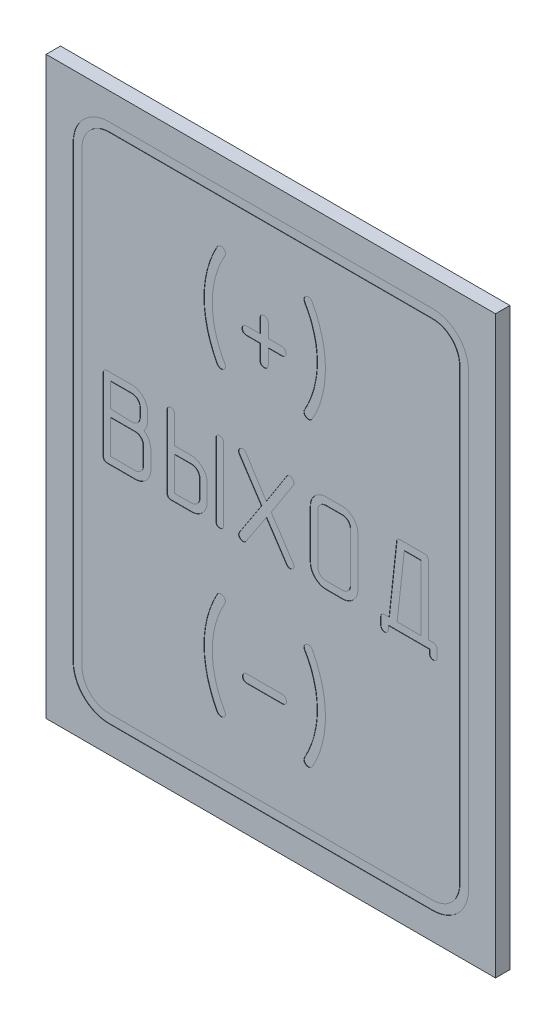
from build123d import *

# Parameters (mm, degrees)
SKETCH_1_W               = 25
SKETCH_1_H               = 32
EXTRUDE_1_DEPTH          = 0.8
CUT_EXTRUDE_1_DEPTH      = 0.02
CUT_EXTRUDE_1_DEPTH_BACK = 0.02
CUT_EXTRUDE_1_2_DEPTH    = 0.02


with BuildPart() as part:
    # Эскиз1 → Вытянуть1 (new body)
    with BuildSketch(Plane.XY):
        Rectangle(SKETCH_1_W, SKETCH_1_H)
    extrude(amount=EXTRUDE_1_DEPTH)

    # Эскиз2 → Cut-Extrude 1 (cut, two sides: drawn at the far end of the back side and taken through both)
    with BuildSketch(Plane.XY.offset(0.8).offset(-CUT_EXTRUDE_1_DEPTH_BACK)):
        with BuildLine():
            Line((-9, -14.5), (9, -14.5))
            ThreePointArc((9, -14.5), (10.414213562, -13.914213562), (11, -12.5))
            Line((11, -12.5), (11, 12.5))
            ThreePointArc((11, 12.5), (10.414213562, 13.914213562), (9, 14.5))
            Line((9, 14.5), (-9, 14.5))
            ThreePointArc((-9, 14.5), (-10.414213562, 13.914213562), (-11, 12.5))
            Line((-11, 12.5), (-11, -12.5))
            ThreePointArc((-11, -12.5), (-10.414213562, -13.914213562), (-9, -14.5))
        make_face()
        with BuildLine():
            Line((-9, -14), (9, -14))
            ThreePointArc((9, -14), (10.060660172, -13.560660172), (10.5, -12.5))
            Line((10.5, -12.5), (10.5, 12.5))
            ThreePointArc((10.5, 12.5), (10.060660172, 13.560660172), (9, 14))
            Line((9, 14), (-9, 14))
            ThreePointArc((-9, 14), (-10.060660172, 13.560660172), (-10.5, 12.5))
            Line((-10.5, 12.5), (-10.5, -12.5))
            ThreePointArc((-10.5, -12.5), (-10.060660172, -13.560660172), (-9, -14))
        make_face(mode=Mode.SUBTRACT)
    extrude(amount=CUT_EXTRUDE_1_DEPTH + CUT_EXTRUDE_1_DEPTH_BACK, mode=Mode.SUBTRACT)

    # Эскиз3 → Cut-Extrude 1 2 (cut)
    # profile 1 of 12: a face of its own
    with BuildSketch(Plane.XY.offset(0.8)):
        with BuildLine():
            add(Edge.make_bspline(
                [(-7.058321948, 0.591776836), (-7.027742918, 0.571346925), (-6.966808596, 0.530636582), (-6.888528762, 0.452906934), (-6.821275379, 0.364324674), (-6.768985356, 0.264195286), (-6.726289918, 0.158129073), (-6.696584245, 0.047007104), (-6.676481874, -0.067218704), (-6.67469526, -0.144829501), (-6.673796512, -0.183871286)],
                knots=[0, 0, 0, 0, 0.974313857, 1.941498972, 2.912237091, 3.915945845, 4.93030387, 5.941881181, 6.964671993, 8, 8, 8, 8], degree=3))
            Line((-6.673796512, -0.183871286), (-6.673796512, -1.091464411))
            add(Edge.make_bspline(
                [(-6.673796512, -1.091464411), (-6.674444225, -1.121976953), (-6.675725056, -1.182314435), (-6.688214502, -1.271083799), (-6.709247409, -1.356478441), (-6.73747977, -1.438563391), (-6.77338716, -1.517889835), (-6.818958703, -1.592968858), (-6.872237386, -1.664954939), (-6.932042309, -1.733453457), (-6.997851717, -1.795850195), (-7.0684157, -1.849758437), (-7.141124286, -1.896680786), (-7.217987037, -1.934483467), (-7.298545154, -1.964016249), (-7.382728539, -1.984140185), (-7.469695008, -1.99842847), (-7.528866371, -1.999472411), (-7.558770493, -2)],
                knots=[0, 0, 0, 0, 1.038553944, 2.05370399, 3.044839953, 4.029314396, 5.005852223, 6.003891933, 7.013786344, 8.052340288, 9.096663258, 10.095906219, 11.072268247, 12.038675251, 13.006561345, 13.987308911, 14.982822805, 16, 16, 16, 16], degree=3))
            Line((-7.558770493, -2), (-9.10629688, -2))
            add(Edge.make_bspline(
                [(-9.10629688, -2), (-9.123633505, -1.999287823), (-9.156451599, -1.997939677), (-9.202172301, -1.987712837), (-9.2414509, -1.970721039), (-9.273573689, -1.945410209), (-9.298240078, -1.912858752), (-9.315536564, -1.873485464), (-9.325771658, -1.827415576), (-9.327079348, -1.794285374), (-9.327775992, -1.77663596)],
                knots=[0, 0, 0, 0, 1.153916628, 2.184355167, 3.102198918, 3.981299518, 4.876930186, 5.794773937, 6.825212475, 8, 8, 8, 8], degree=3))
            Line((-9.327775992, -1.77663596), (-9.327775992, 2.240146904))
            add(Edge.make_bspline(
                [(-9.327775992, 2.240146904), (-9.32704669, 2.257781309), (-9.325677698, 2.290883337), (-9.315817034, 2.337268107), (-9.297102006, 2.37614052), (-9.272692573, 2.408931132), (-9.240299928, 2.434490432), (-9.200230088, 2.451168651), (-9.153621609, 2.461459545), (-9.120179336, 2.46280222), (-9.102527023, 2.463510944)],
                knots=[0, 0, 0, 0, 1.164715309, 2.18631923, 3.105001799, 3.992953645, 4.864517145, 5.793449026, 6.835284691, 8, 8, 8, 8], degree=3))
            Line((-9.102527023, 2.463510944), (-7.753860604, 2.463510944))
            add(Edge.make_bspline(
                [(-7.753860604, 2.463510944), (-7.723026892, 2.462903757), (-7.662361333, 2.461709111), (-7.57344207, 2.448788405), (-7.487787331, 2.429243527), (-7.405998844, 2.401000243), (-7.327949639, 2.364560347), (-7.25306639, 2.321329945), (-7.182047689, 2.269101519), (-7.116147392, 2.209061384), (-7.0550062, 2.144443701), (-7.00057758, 2.07599583), (-6.956879683, 2.002314076), (-6.918151249, 1.927430719), (-6.89018433, 1.847971436), (-6.869152051, 1.765737242), (-6.85668021, 1.679763227), (-6.855398141, 1.6213018), (-6.854749658, 1.591731463)],
                knots=[0, 0, 0, 0, 1.061147515, 2.087815652, 3.08768346, 4.083327943, 5.061119066, 6.050158087, 7.05638581, 8.090551292, 9.116135753, 10.118166958, 11.094160779, 12.061844017, 13.01668066, 13.987564058, 14.982091062, 16, 16, 16, 16], degree=3))
            Line((-6.854749658, 1.591731463), (-6.854749658, 1.15537049))
            add(Edge.make_bspline(
                [(-6.854749658, 1.15537049), (-6.857163973, 1.106148467), (-6.86199472, 1.007661254), (-6.893193921, 0.887403451), (-6.929028709, 0.794347887), (-6.964955896, 0.725518057), (-7.007687845, 0.657314061), (-7.041295569, 0.613814583), (-7.058321948, 0.591776836)],
                knots=[0, 0, 0, 0, 1.448258751, 2.897787606, 3.633103996, 4.382029969, 5.180302451, 6, 6, 6, 6], degree=3))
        make_face()
        with BuildLine():
            Line((-8.905551984, 0.292073187), (-8.905551984, -1.577775992))
            Line((-8.905551984, -1.577775992), (-7.548403386, -1.577775992))
            add(Edge.make_bspline(
                [(-7.548403386, -1.577775992), (-7.518061591, -1.576190846), (-7.458844537, -1.57309717), (-7.373878517, -1.547383008), (-7.296113246, -1.506055089), (-7.226742369, -1.44939858), (-7.16765875, -1.380172184), (-7.125962064, -1.298448996), (-7.100525758, -1.207320204), (-7.097560531, -1.143473113), (-7.09602052, -1.110313697)],
                knots=[0, 0, 0, 0, 1.001355613, 1.954311872, 2.906702074, 3.896084438, 4.898677921, 5.892682449, 6.905550428, 8, 8, 8, 8], degree=3))
            Line((-7.09602052, -1.110313697), (-7.09602052, -0.175389107))
            add(Edge.make_bspline(
                [(-7.09602052, -0.175389107), (-7.097244181, -0.143798016), (-7.099645721, -0.081797812), (-7.125123608, 0.006507287), (-7.165605074, 0.087457806), (-7.222128661, 0.15781627), (-7.2893399, 0.217878659), (-7.367778671, 0.26134127), (-7.455329652, 0.287598845), (-7.516803576, 0.290554087), (-7.548403386, 0.292073187)],
                knots=[0, 0, 0, 0, 1.041747408, 2.044517874, 3.010480817, 4.015989705, 5.009469057, 5.971685018, 6.957373109, 8, 8, 8, 8], degree=3))
            Line((-7.548403386, 0.292073187), (-8.905551984, 0.292073187))
        make_face(mode=Mode.SUBTRACT)
        with BuildLine():
            add(Edge.make_bspline(
                [(-7.742551032, 0.671886302), (-7.711261624, 0.67306676), (-7.650157539, 0.675372039), (-7.562933031, 0.701344191), (-7.482851811, 0.741542998), (-7.411863868, 0.796981938), (-7.351716689, 0.864862169), (-7.307753261, 0.944176199), (-7.281377353, 1.033411728), (-7.278473374, 1.095813008), (-7.276973666, 1.128039025)],
                knots=[0, 0, 0, 0, 1.02919571, 2.009883367, 2.973785129, 3.970760785, 4.962120241, 5.945432109, 6.938955399, 8, 8, 8, 8], degree=3))
            Line((-7.276973666, 1.128039025), (-7.276973666, 1.585134212))
            add(Edge.make_bspline(
                [(-7.276973666, 1.585134212), (-7.278587952, 1.616087513), (-7.281738903, 1.676505748), (-7.306999281, 1.763374722), (-7.349511921, 1.841982234), (-7.406927263, 1.91131031), (-7.476602555, 1.9693023), (-7.55714698, 2.01141699), (-7.647125436, 2.036677194), (-7.710026701, 2.039715777), (-7.742551032, 2.041286936)],
                knots=[0, 0, 0, 0, 1.020163205, 1.991272588, 2.955942624, 3.950072067, 4.94420151, 5.927189003, 6.92821248, 8, 8, 8, 8], degree=3))
            Line((-7.742551032, 2.041286936), (-8.905551984, 2.041286936))
            Line((-8.905551984, 2.041286936), (-8.905551984, 0.714297196))
            Line((-8.905551984, 0.714297196), (-7.742551032, 0.671886302))
        make_face(mode=Mode.SUBTRACT)
    # profile 2 of 12: a face of its own
    with BuildSketch(Plane.XY.offset(0.8)):
        with BuildLine():
            add(Edge.make_bspline(
                [(-2.632509576, -1.77663596), (-2.6331708, -1.793362188), (-2.634447548, -1.825658626), (-2.645981065, -1.871358493), (-2.664589492, -1.91230291), (-2.683477003, -1.934398579), (-2.692827292, -1.94533707)],
                knots=[0, 0, 0, 0, 1.091649492, 2.107850678, 3.063288918, 4, 4, 4, 4], degree=3))
            add(Edge.make_bspline(
                [(-2.692827292, -1.94533707), (-2.702894723, -1.953636468), (-2.722967722, -1.970184263), (-2.759329616, -1.987459105), (-2.800012067, -1.997773872), (-2.828793221, -1.999243059), (-2.84362158, -2)],
                knots=[0, 0, 0, 0, 0.951182289, 1.896519658, 2.916264364, 4, 4, 4, 4], degree=3))
            add(Edge.make_bspline(
                [(-2.84362158, -2), (-2.857524061, -1.999281918), (-2.884480518, -1.997889581), (-2.923328356, -1.986758476), (-2.959724793, -1.969849927), (-2.992565697, -1.945348236), (-3.020929934, -1.913835222), (-3.040450433, -1.874066749), (-3.053261949, -1.827685783), (-3.054223621, -1.794326176), (-3.054733584, -1.77663596)],
                knots=[0, 0, 0, 0, 0.962602444, 1.866454789, 2.78256597, 3.732510206, 4.689672778, 5.693316895, 6.776792436, 8, 8, 8, 8], degree=3))
            Line((-3.054733584, -1.77663596), (-3.054733584, 2.240146904))
            add(Edge.make_bspline(
                [(-3.054733584, 2.240146904), (-3.054110176, 2.255010005), (-3.052867716, 2.284632304), (-3.039606425, 2.327574114), (-3.019871177, 2.368852013), (-3.001166432, 2.393433447), (-2.991588476, 2.406020621)],
                knots=[0, 0, 0, 0, 0.982279067, 1.957691288, 2.954214966, 4, 4, 4, 4], degree=3))
            add(Edge.make_bspline(
                [(-2.991588476, 2.406020621), (-2.980918791, 2.414980326), (-2.959994289, 2.432551356), (-2.923499641, 2.450384653), (-2.884470356, 2.461359667), (-2.857520603, 2.46277896), (-2.84362158, 2.463510944)],
                knots=[0, 0, 0, 0, 1.025879868, 2.011870596, 2.974645281, 4, 4, 4, 4], degree=3))
            add(Edge.make_bspline(
                [(-2.84362158, 2.463510944), (-2.817426152, 2.461177364), (-2.763245288, 2.456350746), (-2.71867571, 2.42502721), (-2.695654684, 2.408848014)],
                knots=[0, 0, 0, 0, 0.96696239, 2, 2, 2, 2], degree=3))
            add(Edge.make_bspline(
                [(-2.695654684, 2.408848014), (-2.685972263, 2.3985804), (-2.66630899, 2.377728705), (-2.646824918, 2.337528655), (-2.633971652, 2.291211289), (-2.633016227, 2.257842166), (-2.632509576, 2.240146904)],
                knots=[0, 0, 0, 0, 0.909097505, 1.846215167, 2.857872634, 4, 4, 4, 4], degree=3))
            Line((-2.632509576, 2.240146904), (-2.632509576, -1.77663596))
        make_face()
    # profile 3 of 12: a face of its own
    with BuildSketch(Plane.XY.offset(0.8)):
        with BuildLine():
            Line((-5.346806772, 0.714297196), (-4.44204104, 0.714297196))
            add(Edge.make_bspline(
                [(-4.44204104, 0.714297196), (-4.411840079, 0.713655981), (-4.352123091, 0.712388093), (-4.264321717, 0.699806856), (-4.179649804, 0.679085038), (-4.098441194, 0.649402503), (-4.019769225, 0.612940994), (-3.944847621, 0.567024068), (-3.872953423, 0.513012601), (-3.804986204, 0.451334072), (-3.742427912, 0.384281422), (-3.687120362, 0.313240802), (-3.640653157, 0.238381474), (-3.602751816, 0.159720095), (-3.573271482, 0.077261051), (-3.553022547, -0.009083644), (-3.538865064, -0.098584544), (-3.537808955, -0.15962507), (-3.537275308, -0.190468536)],
                knots=[0, 0, 0, 0, 1.018784201, 2.014463209, 2.986545793, 3.955848676, 4.928220356, 5.908365375, 6.915663229, 7.959143197, 9.001976513, 10.007263344, 10.992955805, 11.969883834, 12.949168196, 13.941850462, 14.960027538, 16, 16, 16, 16], degree=3))
            Line((-3.537275308, -0.190468536), (-3.537275308, -1.095234268))
            add(Edge.make_bspline(
                [(-3.537275308, -1.095234268), (-3.537905485, -1.125748231), (-3.539145209, -1.185777207), (-3.551787882, -1.274220853), (-3.572699991, -1.358975698), (-3.600643401, -1.441242498), (-3.639381338, -1.518964653), (-3.683020769, -1.595465732), (-3.737508729, -1.666696578), (-3.798287567, -1.734225997), (-3.864857972, -1.796010235), (-3.935076105, -1.850968539), (-4.009666832, -1.896497432), (-4.086854903, -1.934355927), (-4.167680293, -1.964014583), (-4.2521585, -1.984250702), (-4.339779742, -1.998412046), (-4.399572547, -1.999466918), (-4.429789004, -2)],
                knots=[0, 0, 0, 0, 1.036585177, 2.039235185, 3.02849227, 4.001012594, 4.984780344, 5.975476935, 6.989827136, 8.025532079, 9.060576355, 10.072901455, 11.050799382, 12.02495951, 12.9910108, 13.969899181, 14.974083033, 16, 16, 16, 16], degree=3))
            Line((-4.429789004, -2), (-5.54566674, -2))
            add(Edge.make_bspline(
                [(-5.54566674, -2), (-5.5633148, -1.999302323), (-5.59644246, -1.997992695), (-5.642529018, -1.987770314), (-5.681847692, -1.970432175), (-5.714793452, -1.945762672), (-5.739462955, -1.912816912), (-5.756801094, -1.873498238), (-5.767023475, -1.827411681), (-5.768333103, -1.79428402), (-5.76903078, -1.77663596)],
                knots=[0, 0, 0, 0, 1.169320809, 2.19496434, 3.108537029, 4, 4.891462971, 5.80503566, 6.830679191, 8, 8, 8, 8], degree=3))
            Line((-5.76903078, -1.77663596), (-5.76903078, 2.240146904))
            add(Edge.make_bspline(
                [(-5.76903078, 2.240146904), (-5.768407371, 2.255010005), (-5.767164912, 2.284632304), (-5.753903621, 2.327574114), (-5.734168373, 2.368852013), (-5.715463627, 2.393433447), (-5.705885671, 2.406020621)],
                knots=[0, 0, 0, 0, 0.982279067, 1.957691288, 2.954214966, 4, 4, 4, 4], degree=3))
            add(Edge.make_bspline(
                [(-5.705885671, 2.406020621), (-5.695215987, 2.414980326), (-5.674291484, 2.432551356), (-5.637796837, 2.450384653), (-5.598767552, 2.461359667), (-5.571817799, 2.46277896), (-5.557918776, 2.463510944)],
                knots=[0, 0, 0, 0, 1.025879868, 2.011870596, 2.974645281, 4, 4, 4, 4], degree=3))
            add(Edge.make_bspline(
                [(-5.557918776, 2.463510944), (-5.54470078, 2.462598603), (-5.518565235, 2.46079466), (-5.479811645, 2.452040001), (-5.44494816, 2.432378673), (-5.410453909, 2.410164918), (-5.382343513, 2.378526784), (-5.36037371, 2.340345437), (-5.348617076, 2.29453937), (-5.34742708, 2.261882323), (-5.346806772, 2.244859225)],
                knots=[0, 0, 0, 0, 0.932128925, 1.843070333, 2.762014309, 3.730358309, 4.715692096, 5.704981078, 6.803678338, 8, 8, 8, 8], degree=3))
            Line((-5.346806772, 2.244859225), (-5.346806772, 0.714297196))
        make_face()
        with BuildLine():
            Line((-5.346806772, 0.292073187), (-5.346806772, -1.577775992))
            Line((-5.346806772, -1.577775992), (-4.422249289, -1.577775992))
            add(Edge.make_bspline(
                [(-4.422249289, -1.577775992), (-4.391290878, -1.576155482), (-4.330560321, -1.572976556), (-4.243358019, -1.547579036), (-4.163558879, -1.506360066), (-4.093110373, -1.449418193), (-4.033056168, -1.380249986), (-3.990472913, -1.2985299), (-3.963751135, -1.207467372), (-3.960951423, -1.143494217), (-3.959499316, -1.110313697)],
                knots=[0, 0, 0, 0, 1.010490066, 1.982260146, 2.942076745, 3.92827771, 4.926168966, 5.913705344, 6.917915763, 8, 8, 8, 8], degree=3))
            Line((-3.959499316, -1.110313697), (-3.959499316, -0.175389107))
            add(Edge.make_bspline(
                [(-3.959499316, -0.175389107), (-3.961141985, -0.143815463), (-3.964364529, -0.081875136), (-3.98928628, 0.006767757), (-4.031147041, 0.087455822), (-4.088479764, 0.158187766), (-4.15766286, 0.217923486), (-4.237922189, 0.261367751), (-4.327328236, 0.287591164), (-4.390026108, 0.290551659), (-4.422249289, 0.292073187)],
                knots=[0, 0, 0, 0, 1.031458276, 2.023487069, 2.983784744, 3.984920739, 4.983312156, 5.953232731, 6.9480767, 8, 8, 8, 8], degree=3))
            Line((-4.422249289, 0.292073187), (-5.346806772, 0.292073187))
        make_face(mode=Mode.SUBTRACT)
    # profile 4 of 12: a face of its own
    with BuildSketch(Plane.XY.offset(0.8)):
        with BuildLine():
            Line((-0.249959816, 0.593661765), (0.880997349, 2.365494656))
            add(Edge.make_bspline(
                [(0.880997349, 2.365494656), (0.891631217, 2.380303842), (0.913417826, 2.41064482), (0.943713358, 2.432520735), (0.959221887, 2.443719193)],
                knots=[0, 0, 0, 0, 0.976183803, 2, 2, 2, 2], degree=3))
            Line((0.959221887, 2.443719193), (1.006345102, 2.463510944))
            Line((1.006345102, 2.463510944), (1.059123103, 2.463510944))
            add(Edge.make_bspline(
                [(1.059123103, 2.463510944), (1.073054272, 2.46289734), (1.101544768, 2.461642464), (1.142647077, 2.447518609), (1.183078186, 2.426239595), (1.206814077, 2.406219991), (1.219342034, 2.395653514)],
                knots=[0, 0, 0, 0, 0.935580722, 1.913346781, 2.898650922, 4, 4, 4, 4], degree=3))
            add(Edge.make_bspline(
                [(1.219342034, 2.395653514), (1.229839695, 2.383743703), (1.25011974, 2.360735577), (1.272623896, 2.32126052), (1.285062514, 2.278580355), (1.287105333, 2.24933315), (1.288141929, 2.234492118)],
                knots=[0, 0, 0, 0, 1.05869681, 2.045257594, 3.00809679, 4, 4, 4, 4], degree=3))
            add(Edge.make_bspline(
                [(1.288141929, 2.234492118), (1.286120631, 2.214064148), (1.281722895, 2.169619027), (1.261416486, 2.129747554), (1.250443356, 2.108201901)],
                knots=[0, 0, 0, 0, 0.91924468, 2, 2, 2, 2], degree=3))
            Line((1.250443356, 2.108201901), (0.021469904, 0.201596614))
            Line((0.021469904, 0.201596614), (1.250443356, -1.6541156))
            Line((1.250443356, -1.6541156), (1.278717286, -1.720088102))
            Line((1.278717286, -1.720088102), (1.288141929, -1.780405817))
            add(Edge.make_bspline(
                [(1.288141929, -1.780405817), (1.28763938, -1.794370991), (1.286644031, -1.822030424), (1.271625715, -1.861570076), (1.251428656, -1.900137234), (1.22101856, -1.933544139), (1.186732781, -1.963776621), (1.146325149, -1.983932439), (1.102860291, -1.998652277), (1.072136438, -1.99954152), (1.05629571, -2)],
                knots=[0, 0, 0, 0, 0.942423544, 1.866564797, 2.840331854, 3.883796094, 4.91343319, 5.924789933, 6.930054789, 8, 8, 8, 8], degree=3))
            add(Edge.make_bspline(
                [(1.05629571, -2), (1.039427407, -1.998759549), (1.006151558, -1.996312528), (0.959161631, -1.975457311), (0.915422443, -1.944101557), (0.892850995, -1.914632382), (0.880997349, -1.899156319)],
                knots=[0, 0, 0, 0, 0.959012013, 1.891828641, 2.892870503, 4, 4, 4, 4], degree=3))
            Line((0.880997349, -1.899156319), (-0.249959816, -0.190468536))
            Line((-0.249959816, -0.190468536), (-1.38091698, -1.899156319))
            add(Edge.make_bspline(
                [(-1.38091698, -1.899156319), (-1.3913265, -1.912962203), (-1.41491222, -1.944243346), (-1.447521527, -1.966108383), (-1.465738768, -1.978323321)],
                knots=[0, 0, 0, 0, 0.882696833, 2, 2, 2, 2], degree=3))
            Line((-1.465738768, -1.978323321), (-1.562812591, -2))
            add(Edge.make_bspline(
                [(-1.562812591, -2), (-1.574884456, -1.999384724), (-1.60004763, -1.998102214), (-1.637404167, -1.982719964), (-1.677396858, -1.962436387), (-1.702883824, -1.943273312), (-1.716434273, -1.933085034)],
                knots=[0, 0, 0, 0, 0.844962514, 1.761280397, 2.809758025, 4, 4, 4, 4], degree=3))
            add(Edge.make_bspline(
                [(-1.716434273, -1.933085034), (-1.727308405, -1.921866721), (-1.74860258, -1.899898557), (-1.771417169, -1.860600409), (-1.785234675, -1.818066376), (-1.787111954, -1.788675625), (-1.78806156, -1.773808567)],
                knots=[0, 0, 0, 0, 1.04087641, 2.038287071, 3.007684418, 4, 4, 4, 4], degree=3))
            add(Edge.make_bspline(
                [(-1.78806156, -1.773808567), (-1.786101094, -1.75335632), (-1.781891219, -1.709437476), (-1.761342515, -1.670309847), (-1.750362988, -1.649403279)],
                knots=[0, 0, 0, 0, 0.931365442, 2, 2, 2, 2], degree=3))
            Line((-1.750362988, -1.649403279), (-0.521389535, 0.231755472))
            Line((-0.521389535, 0.231755472), (-1.756960238, 2.112914223))
            Line((-1.756960238, 2.112914223), (-1.78806156, 2.179829188))
            Line((-1.78806156, 2.179829188), (-1.78806156, 2.241089368))
            add(Edge.make_bspline(
                [(-1.78806156, 2.241089368), (-1.787514738, 2.255038433), (-1.786419976, 2.282965117), (-1.771820258, 2.323003104), (-1.751239324, 2.361408061), (-1.721657251, 2.395877608), (-1.686704903, 2.425805096), (-1.646717491, 2.44799929), (-1.602507786, 2.460618878), (-1.572003204, 2.462524616), (-1.556215341, 2.463510944)],
                knots=[0, 0, 0, 0, 0.937467563, 1.876854201, 2.845500448, 3.869722928, 4.923840179, 5.939897876, 6.933779486, 8, 8, 8, 8], degree=3))
            add(Edge.make_bspline(
                [(-1.556215341, 2.463510944), (-1.539346408, 2.462284518), (-1.505655826, 2.459835105), (-1.458399874, 2.438409198), (-1.41499826, 2.405199078), (-1.392754481, 2.374979433), (-1.38091698, 2.358897406)],
                knots=[0, 0, 0, 0, 0.947751478, 1.892846324, 2.878633355, 4, 4, 4, 4], degree=3))
            Line((-1.38091698, 2.358897406), (-0.249959816, 0.593661765))
        make_face()
    # profile 5 of 12: a face of its own
    with BuildSketch(Plane.XY.offset(0.8)):
        with BuildLine():
            add(Edge.make_bspline(
                [(4.846887141, -1.107486304), (4.846253329, -1.137686601), (4.845006612, -1.197091021), (4.832462721, -1.284294459), (4.811459544, -1.3678249), (4.782991753, -1.448243052), (4.747309782, -1.526406), (4.701673086, -1.600502574), (4.648679143, -1.671466754), (4.588642213, -1.73828701), (4.522212023, -1.798610683), (4.45258818, -1.85273555), (4.379496425, -1.898587116), (4.302480823, -1.935289921), (4.2221503, -1.964929124), (4.13804084, -1.985383348), (4.050897608, -1.998112887), (3.99180204, -1.99936614), (3.961913159, -2)],
                knots=[0, 0, 0, 0, 1.037122832, 2.040035617, 3.019141001, 3.992098752, 4.967627701, 5.965415826, 6.975736262, 8.007509145, 9.046540002, 10.054782536, 11.034185367, 12.004565107, 12.981168362, 13.970748924, 14.973661709, 16, 16, 16, 16], degree=3))
            Line((3.961913159, -2), (3.077881642, -2))
            add(Edge.make_bspline(
                [(3.077881642, -2), (3.048310771, -1.999350908), (2.989848289, -1.998067633), (2.903881985, -1.985604604), (2.821045435, -1.964392954), (2.741146049, -1.936271672), (2.663783678, -1.900683863), (2.591203508, -1.854198221), (2.520447367, -1.80187017), (2.453706742, -1.741718728), (2.393124534, -1.675205498), (2.33907797, -1.605000954), (2.294472049, -1.530414552), (2.257549152, -1.452787354), (2.227993308, -1.371468103), (2.207519274, -1.286435272), (2.194751678, -1.198039074), (2.193529115, -1.13800358), (2.19290766, -1.107486304)],
                knots=[0, 0, 0, 0, 1.015308535, 2.007294869, 2.975697998, 3.948420628, 4.913933354, 5.893099506, 6.903175791, 7.93469934, 8.973479108, 9.990048541, 10.972776172, 11.952655656, 12.939168026, 13.938988876, 14.952345666, 16, 16, 16, 16], degree=3))
            Line((2.19290766, -1.107486304), (2.19290766, 1.570997248))
            add(Edge.make_bspline(
                [(2.19290766, 1.570997248), (2.193507481, 1.601518889), (2.194687486, 1.661562971), (2.207754184, 1.749824291), (2.227031859, 1.834916778), (2.255503498, 1.916470077), (2.292587601, 1.993945637), (2.337075716, 2.067812392), (2.389462417, 2.138205274), (2.449299081, 2.204250772), (2.514536223, 2.265242309), (2.584562713, 2.318478428), (2.658543367, 2.362576542), (2.735171045, 2.400095926), (2.815988439, 2.428124624), (2.900132707, 2.449094962), (2.987971372, 2.461582558), (3.047683261, 2.462863252), (3.077881642, 2.463510944)],
                knots=[0, 0, 0, 0, 1.045837316, 2.057436573, 3.05302036, 4.034221007, 5.012401019, 5.993424239, 6.986673985, 8.016408493, 9.045466582, 10.04517987, 11.026203091, 11.994665743, 12.965701314, 13.953326856, 14.964926113, 16, 16, 16, 16], degree=3))
            Line((3.077881642, 2.463510944), (3.961913159, 2.463510944))
            add(Edge.make_bspline(
                [(3.961913159, 2.463510944), (3.992110595, 2.462861369), (4.051820614, 2.46157695), (4.139672947, 2.449116587), (4.22376699, 2.428046175), (4.304898622, 2.400338628), (4.380953117, 2.36136584), (4.455589692, 2.317721551), (4.52494462, 2.263244771), (4.59050108, 2.20240096), (4.650655626, 2.13623702), (4.702418331, 2.065080706), (4.747272396, 1.991157818), (4.784070948, 1.913872128), (4.812784495, 1.833060405), (4.832137951, 1.748586656), (4.84504796, 1.660929921), (4.846269411, 1.601203154), (4.846887141, 1.570997248)],
                knots=[0, 0, 0, 0, 1.035817767, 2.048144033, 3.036479355, 4.008212784, 4.982096596, 5.963824851, 6.970798663, 8.000596308, 9.031070859, 10.033707362, 11.015435617, 11.994318621, 12.966052049, 13.951855967, 14.964182233, 16, 16, 16, 16], degree=3))
            Line((4.846887141, 1.570997248), (4.846887141, -1.107486304))
        make_face()
        with BuildLine():
            Line((4.424663132, -1.125393126), (4.424663132, 1.58890407))
            add(Edge.make_bspline(
                [(4.424663132, 1.58890407), (4.423506542, 1.619583606), (4.421248135, 1.679489754), (4.394854364, 1.764929163), (4.355632781, 1.84407248), (4.298086216, 1.911829718), (4.231296583, 1.970132364), (4.15254847, 2.011394235), (4.06523825, 2.036629275), (4.003870643, 2.0397041), (3.972280266, 2.041286936)],
                knots=[0, 0, 0, 0, 1.02750581, 2.006350931, 2.978970947, 3.976537614, 4.972762713, 5.940903496, 6.940033048, 8, 8, 8, 8], degree=3))
            Line((3.972280266, 2.041286936), (3.067514535, 2.041286936))
            add(Edge.make_bspline(
                [(3.067514535, 2.041286936), (3.036886515, 2.039575668), (2.97689089, 2.036223554), (2.890434702, 2.012162939), (2.811159378, 1.971193685), (2.766763569, 1.932030178), (2.744249278, 1.912169326)],
                knots=[0, 0, 0, 0, 1.029004864, 2.015663768, 2.993690518, 4, 4, 4, 4], degree=3))
            add(Edge.make_bspline(
                [(2.744249278, 1.912169326), (2.724348986, 1.889674921), (2.684922473, 1.845108944), (2.644485163, 1.765231881), (2.620244148, 1.678910068), (2.616853767, 1.619221889), (2.615131669, 1.58890407)],
                knots=[0, 0, 0, 0, 1.00659897, 1.994276692, 2.98121943, 4, 4, 4, 4], degree=3))
            Line((2.615131669, 1.58890407), (2.615131669, -1.125393126))
            add(Edge.make_bspline(
                [(2.615131669, -1.125393126), (2.616842937, -1.156021146), (2.62019505, -1.216016771), (2.644255665, -1.302472958), (2.685224919, -1.381748282), (2.724388426, -1.426144091), (2.744249278, -1.448658382)],
                knots=[0, 0, 0, 0, 1.029004864, 2.015663768, 2.993690518, 4, 4, 4, 4], degree=3))
            add(Edge.make_bspline(
                [(2.744249278, -1.448658382), (2.76730014, -1.467330367), (2.812720315, -1.50412226), (2.864089565, -1.532001671), (2.889388781, -1.545732205)],
                knots=[0, 0, 0, 0, 1.015005409, 2, 2, 2, 2], degree=3))
            add(Edge.make_bspline(
                [(2.889388781, -1.545732205), (2.920273452, -1.55482215), (2.978516309, -1.571964127), (3.039070605, -1.575918513), (3.067514535, -1.577775992)],
                knots=[0, 0, 0, 0, 1.06054792, 2, 2, 2, 2], degree=3))
            Line((3.067514535, -1.577775992), (3.972280266, -1.577775992))
            add(Edge.make_bspline(
                [(3.972280266, -1.577775992), (4.00260542, -1.57650042), (4.061728804, -1.574013504), (4.14675703, -1.549348392), (4.224212666, -1.508860804), (4.293916786, -1.454281977), (4.352648819, -1.386998405), (4.394737737, -1.308017853), (4.420160875, -1.219611607), (4.423123513, -1.157612656), (4.424663132, -1.125393126)],
                knots=[0, 0, 0, 0, 1.016449325, 1.981718699, 2.944447279, 3.936507135, 4.939060545, 5.920968299, 6.919571676, 8, 8, 8, 8], degree=3))
        make_face(mode=Mode.SUBTRACT)
    # profile 6 of 12: a face of its own
    with BuildSketch(Plane.XY.offset(0.8)):
        with BuildLine():
            Line((6.578194067, -1.577775992), (6.998533147, 2.276903012))
            add(Edge.make_bspline(
                [(6.998533147, 2.276903012), (6.999274097, 2.291418224), (7.000696244, 2.319278088), (7.010908711, 2.358215856), (7.028193694, 2.39183806), (7.053228852, 2.418501858), (7.085302898, 2.439150393), (7.123754834, 2.453809086), (7.169395286, 2.462172731), (7.201754244, 2.463044469), (7.219069794, 2.463510944)],
                knots=[0, 0, 0, 0, 1.053810548, 2.022637772, 2.900648452, 3.772706449, 4.646256419, 5.650718974, 6.742880019, 8, 8, 8, 8], degree=3))
            Line((7.219069794, 2.463510944), (8.546059534, 2.463510944))
            add(Edge.make_bspline(
                [(8.546059534, 2.463510944), (8.563396393, 2.462798868), (8.596214931, 2.461450913), (8.641932685, 2.451222802), (8.681220929, 2.43423516), (8.713309785, 2.408909709), (8.73828125, 2.376183064), (8.755075195, 2.336265453), (8.765583126, 2.290005401), (8.766858967, 2.256861273), (8.767538645, 2.239204439)],
                knots=[0, 0, 0, 0, 1.151165151, 2.179146642, 3.094801823, 3.971806236, 4.865301301, 5.800032228, 6.828013719, 8, 8, 8, 8], degree=3))
            Line((8.767538645, 2.239204439), (8.767538645, -1.577775992))
            Line((8.767538645, -1.577775992), (9.008809507, -1.577775992))
            add(Edge.make_bspline(
                [(9.008809507, -1.577775992), (9.027733788, -1.578036828), (9.063401142, -1.578528435), (9.112795394, -1.589514945), (9.155795916, -1.604742566), (9.190197529, -1.629068906), (9.218152814, -1.659175958), (9.236604508, -1.69687632), (9.248398696, -1.740744695), (9.24949569, -1.77214969), (9.250080369, -1.788887996)],
                knots=[0, 0, 0, 0, 1.23372879, 2.325258308, 3.293962694, 4.194060993, 5.051935919, 5.952034218, 6.908470482, 8, 8, 8, 8], degree=3))
            Line((9.250080369, -1.788887996), (9.250080369, -2.211112004))
            add(Edge.make_bspline(
                [(9.250080369, -2.211112004), (9.249481101, -2.225344687), (9.248311293, -2.253127739), (9.23530298, -2.29310485), (9.213873923, -2.32917725), (9.18631454, -2.362116105), (9.152286039, -2.387357185), (9.117220209, -2.408588298), (9.078607959, -2.420001017), (9.052226482, -2.421480492), (9.038968365, -2.422224008)],
                knots=[0, 0, 0, 0, 1.031748002, 2.014034101, 3.016814067, 4.069579463, 5.111138284, 6.082747043, 7.036476891, 8, 8, 8, 8], degree=3))
            add(Edge.make_bspline(
                [(9.038968365, -2.422224008), (9.014670485, -2.419365978), (8.963345389, -2.413328879), (8.905008167, -2.37928676), (8.86533863, -2.340646226), (8.842399887, -2.303327397), (8.830829893, -2.258897734), (8.828876426, -2.227504811), (8.827856361, -2.211112004)],
                knots=[0, 0, 0, 0, 1.313694866, 2.774954664, 3.544261478, 4.299350482, 5.111952142, 6, 6, 6, 6], degree=3))
            Line((8.827856361, -2.211112004), (8.827856361, -2))
            Line((8.827856361, -2), (6.535783173, -2))
            Line((6.535783173, -2), (6.535783173, -2.211112004))
            add(Edge.make_bspline(
                [(6.535783173, -2.211112004), (6.535183905, -2.225344687), (6.534014097, -2.253127739), (6.521005784, -2.29310485), (6.499576727, -2.32917725), (6.472017345, -2.362116105), (6.437988844, -2.387357185), (6.402923013, -2.408588298), (6.364310764, -2.420001017), (6.337929286, -2.421480492), (6.324671169, -2.422224008)],
                knots=[0, 0, 0, 0, 1.031748002, 2.014034101, 3.016814067, 4.069579463, 5.111138284, 6.082747043, 7.036476891, 8, 8, 8, 8], degree=3))
            add(Edge.make_bspline(
                [(6.324671169, -2.422224008), (6.300373289, -2.419365978), (6.249048193, -2.413328879), (6.190710971, -2.37928676), (6.151041435, -2.340646226), (6.128102692, -2.303327397), (6.116532698, -2.258897734), (6.11457923, -2.227504811), (6.113559165, -2.211112004)],
                knots=[0, 0, 0, 0, 1.313694866, 2.774954664, 3.544261478, 4.299350482, 5.111952142, 6, 6, 6, 6], degree=3))
            Line((6.113559165, -2.211112004), (6.113559165, -1.788887996))
            add(Edge.make_bspline(
                [(6.113559165, -1.788887996), (6.114213464, -1.772158403), (6.115438034, -1.740847685), (6.126253833, -1.697211542), (6.142508706, -1.659341129), (6.168525892, -1.629437756), (6.199880469, -1.604995472), (6.239417627, -1.589428714), (6.284811381, -1.578588837), (6.31768288, -1.578056862), (6.335038277, -1.577775992)],
                knots=[0, 0, 0, 0, 1.142786369, 2.138812389, 3.062348774, 3.932270476, 4.822416454, 5.756900313, 6.815694862, 8, 8, 8, 8], degree=3))
            Line((6.335038277, -1.577775992), (6.578194067, -1.577775992))
        make_face()
        Polygon((8.345314637, -1.577775992), (8.345314637, 2.041286936), (7.428296869, 2.041286936), (7.025864611, -1.577775992), align=None, mode=Mode.SUBTRACT)
    # profile 7 of 12: a face of its own
    with BuildSketch(Plane.XY.offset(0.8)):
        with BuildLine():
            add(Edge.make_bspline(
                [(-2.560254422, 6.065139006), (-2.549843656, 6.043448519), (-2.530587295, 6.003328526), (-2.526084437, 5.959126752), (-2.524016006, 5.938822241)],
                knots=[0, 0, 0, 0, 1.081280692, 2, 2, 2, 2], degree=3))
            add(Edge.make_bspline(
                [(-2.524016006, 5.938822241), (-2.525051453, 5.923515903), (-2.527099928, 5.893234643), (-2.542559076, 5.84928344), (-2.567681763, 5.808750404), (-2.601930113, 5.773050086), (-2.641827633, 5.743193022), (-2.685989593, 5.721195034), (-2.732977374, 5.706914988), (-2.765505394, 5.705523696), (-2.781826452, 5.70482561)],
                knots=[0, 0, 0, 0, 0.954706788, 1.888742218, 2.875999689, 3.913081199, 4.960863747, 5.97322499, 6.983057913, 8, 8, 8, 8], degree=3))
            add(Edge.make_bspline(
                [(-2.781826452, 5.70482561), (-2.800369416, 5.70654076), (-2.838266947, 5.710046131), (-2.892436988, 5.735940553), (-2.94322495, 5.776988186), (-2.972281476, 5.812235376), (-2.987867733, 5.831142375)],
                knots=[0, 0, 0, 0, 0.887403083, 1.813646829, 2.827214876, 4, 4, 4, 4], degree=3))
            add(Edge.make_bspline(
                [(-2.987867733, 5.831142375), (-3.041389151, 5.935053396), (-3.150378485, 6.146654534), (-3.290137818, 6.48250978), (-3.420181877, 6.836810914), (-3.491817426, 7.082796625), (-3.528337826, 7.208202191)],
                knots=[0, 0, 0, 0, 0.945959891, 1.926323009, 2.942822186, 4, 4, 4, 4], degree=3))
            add(Edge.make_bspline(
                [(-3.528337826, 7.208202191), (-3.541472357, 7.262306189), (-3.568404671, 7.373246268), (-3.602746768, 7.545431059), (-3.636661556, 7.726418597), (-3.664437429, 7.915102845), (-3.690433574, 8.10610241), (-3.705451776, 8.295214411), (-3.718691348, 8.479125304), (-3.719489553, 8.600078096), (-3.71988374, 8.659809605)],
                knots=[0, 0, 0, 0, 0.9104263, 1.86682629, 2.87095142, 3.921453174, 4.985589085, 6.022431026, 7.023394351, 8, 8, 8, 8], degree=3))
            add(Edge.make_bspline(
                [(-3.71988374, 8.659809605), (-3.717730713, 8.783102036), (-3.713446516, 9.028435249), (-3.677840671, 9.393933102), (-3.621622646, 9.75516987), (-3.539722777, 10.111674682), (-3.438110336, 10.464604992), (-3.310118918, 10.811665924), (-3.163615293, 11.155862648), (-3.046732461, 11.377759935), (-2.987867733, 11.489512219)],
                knots=[0, 0, 0, 0, 1.001594137, 1.993020224, 2.981013808, 3.970164809, 4.963207675, 5.962990443, 6.974117834, 8, 8, 8, 8], degree=3))
            add(Edge.make_bspline(
                [(-2.987867733, 11.489512219), (-2.976167917, 11.508144286), (-2.952432712, 11.545942825), (-2.915487683, 11.571017505), (-2.896754001, 11.583732101)],
                knots=[0, 0, 0, 0, 0.985861818, 2, 2, 2, 2], degree=3))
            add(Edge.make_bspline(
                [(-2.896754001, 11.583732101), (-2.8783371, 11.591711324), (-2.840405855, 11.608145242), (-2.799674968, 11.615269793), (-2.778720302, 11.618935134)],
                knots=[0, 0, 0, 0, 0.971067578, 2, 2, 2, 2], degree=3))
            add(Edge.make_bspline(
                [(-2.778720302, 11.618935134), (-2.76134955, 11.618300663), (-2.727424665, 11.61706155), (-2.679173903, 11.602599933), (-2.634307342, 11.58141019), (-2.60984625, 11.559541583), (-2.597528221, 11.548529068)],
                knots=[0, 0, 0, 0, 1.041994243, 2.035003056, 3.010473911, 4, 4, 4, 4], degree=3))
            add(Edge.make_bspline(
                [(-2.597528221, 11.548529068), (-2.586209865, 11.53763388), (-2.563915109, 11.516172675), (-2.541020441, 11.474872718), (-2.525486912, 11.428499853), (-2.524519649, 11.395088012), (-2.524016006, 11.37769082)],
                knots=[0, 0, 0, 0, 0.976220527, 1.922946996, 2.9185005, 4, 4, 4, 4], degree=3))
            add(Edge.make_bspline(
                [(-2.524016006, 11.37769082), (-2.526170344, 11.358438388), (-2.53095923, 11.315642091), (-2.549857673, 11.276854249), (-2.560254422, 11.255515588)],
                knots=[0, 0, 0, 0, 0.899724229, 2, 2, 2, 2], degree=3))
            add(Edge.make_bspline(
                [(-2.560254422, 11.255515588), (-2.587181622, 11.208079562), (-2.640552946, 11.114058519), (-2.713950511, 10.97048113), (-2.783497584, 10.824645754), (-2.848376698, 10.674045473), (-2.909448565, 10.517125382), (-2.96748376, 10.354511249), (-3.022673184, 10.183724793), (-3.057793582, 10.066959764), (-3.075875315, 10.006843305)],
                knots=[0, 0, 0, 0, 0.966382599, 1.915428172, 2.856400994, 3.828801601, 4.820187981, 5.839527691, 6.887681112, 8, 8, 8, 8], degree=3))
            add(Edge.make_bspline(
                [(-3.075875315, 10.006843305), (-3.103697769, 9.893972237), (-3.158907928, 9.669993801), (-3.213043375, 9.331023025), (-3.249507829, 8.994692355), (-3.253865105, 8.771035767), (-3.256032013, 8.659809605)],
                knots=[0, 0, 0, 0, 1.023386728, 2.030782233, 3.020692685, 4, 4, 4, 4], degree=3))
            add(Edge.make_bspline(
                [(-3.256032013, 8.659809605), (-3.253657933, 8.546196094), (-3.248929309, 8.319903951), (-3.21655936, 7.982845926), (-3.16086806, 7.650738792), (-3.086063812, 7.322793822), (-2.986691371, 7.00050888), (-2.867533671, 6.682412203), (-2.725936642, 6.369375191), (-2.615719669, 6.166987805), (-2.560254422, 6.065139006)],
                knots=[0, 0, 0, 0, 1.003613848, 1.998969349, 2.987874377, 3.976666606, 4.968092171, 5.964730891, 6.975777496, 8, 8, 8, 8], degree=3))
        make_face()
    # profile 8 of 12: a face of its own
    with BuildSketch(Plane.XY.offset(0.8)):
        with BuildLine():
            Line((-0.141598987, 8.024084247), (-0.141598987, 7.228909857))
            add(Edge.make_bspline(
                [(-0.141598987, 7.228909857), (-0.142343984, 7.209166749), (-0.143784779, 7.170984363), (-0.156176139, 7.116935893), (-0.177030139, 7.068493276), (-0.197614976, 7.041489716), (-0.207863519, 7.028045493)],
                knots=[0, 0, 0, 0, 1.095807949, 2.119249032, 3.063633259, 4, 4, 4, 4], degree=3))
            add(Edge.make_bspline(
                [(-0.207863519, 7.028045493), (-0.21886003, 7.018171974), (-0.240583609, 6.998666863), (-0.280855315, 6.978766865), (-0.32545621, 6.966014515), (-0.357210655, 6.964585764), (-0.37352485, 6.963851727)],
                knots=[0, 0, 0, 0, 0.96880233, 1.913866475, 2.928225937, 4, 4, 4, 4], degree=3))
            add(Edge.make_bspline(
                [(-0.37352485, 6.963851727), (-0.388810884, 6.964568785), (-0.418545595, 6.96596362), (-0.461428093, 6.979349752), (-0.501137738, 7.000293024), (-0.537626782, 7.029206152), (-0.568324175, 7.067062097), (-0.589965314, 7.113979371), (-0.603764111, 7.168769972), (-0.604867389, 7.208110003), (-0.605450714, 7.228909857)],
                knots=[0, 0, 0, 0, 0.924244569, 1.797859888, 2.696172422, 3.633814241, 4.600864981, 5.620774374, 6.742056279, 8, 8, 8, 8], degree=3))
            Line((-0.605450714, 7.228909857), (-0.605450714, 8.024084247))
            Line((-0.605450714, 8.024084247), (-1.350926704, 8.024084247))
            add(Edge.make_bspline(
                [(-1.350926704, 8.024084247), (-1.368959939, 8.024801806), (-1.403765764, 8.026186762), (-1.45324154, 8.039044693), (-1.498039055, 8.059578587), (-1.522840174, 8.080100764), (-1.535224935, 8.090348779)],
                knots=[0, 0, 0, 0, 1.077662133, 2.079988453, 3.041217307, 4, 4, 4, 4], degree=3))
            add(Edge.make_bspline(
                [(-1.535224935, 8.090348779), (-1.54513412, 8.102043565), (-1.564768211, 8.125215653), (-1.583627648, 8.166430574), (-1.597397312, 8.20991845), (-1.598732462, 8.240362509), (-1.599418701, 8.256010111)],
                knots=[0, 0, 0, 0, 1.007594706, 1.996451512, 2.970218466, 4, 4, 4, 4], degree=3))
            add(Edge.make_bspline(
                [(-1.599418701, 8.256010111), (-1.598683707, 8.269934122), (-1.597220113, 8.297660989), (-1.583225266, 8.337938497), (-1.564143709, 8.377989038), (-1.534481407, 8.41447627), (-1.499630131, 8.448314821), (-1.454927487, 8.471125172), (-1.405077728, 8.486326154), (-1.369340905, 8.48738855), (-1.350926704, 8.487935974)],
                knots=[0, 0, 0, 0, 0.880492906, 1.753324448, 2.683883175, 3.682817302, 4.721540691, 5.740681362, 6.835835346, 8, 8, 8, 8], degree=3))
            Line((-1.350926704, 8.487935974), (-0.605450714, 8.487935974))
            Line((-0.605450714, 8.487935974), (-0.605450714, 9.233411965))
            add(Edge.make_bspline(
                [(-0.605450714, 9.233411965), (-0.604724887, 9.249728315), (-0.603263513, 9.282579547), (-0.589092238, 9.330239979), (-0.566871686, 9.375998735), (-0.546561969, 9.403510994), (-0.536080032, 9.417710195)],
                knots=[0, 0, 0, 0, 0.973254022, 1.959543276, 2.946911032, 4, 4, 4, 4], degree=3))
            add(Edge.make_bspline(
                [(-0.536080032, 9.417710195), (-0.524306374, 9.427452517), (-0.501095255, 9.446658967), (-0.46157156, 9.467713496), (-0.418363685, 9.479468212), (-0.388781513, 9.481075184), (-0.37352485, 9.481903961)],
                knots=[0, 0, 0, 0, 1.023169734, 2.017122768, 2.977354028, 4, 4, 4, 4], degree=3))
            add(Edge.make_bspline(
                [(-0.37352485, 9.481903961), (-0.344746774, 9.479340311), (-0.285224135, 9.474037828), (-0.236260373, 9.439626056), (-0.210969669, 9.421851729)],
                knots=[0, 0, 0, 0, 0.96696239, 2, 2, 2, 2], degree=3))
            add(Edge.make_bspline(
                [(-0.210969669, 9.421851729), (-0.200371947, 9.410197458), (-0.179033834, 9.386732026), (-0.156857896, 9.341929731), (-0.143483858, 9.290108083), (-0.142244447, 9.252827128), (-0.141598987, 9.233411965)],
                knots=[0, 0, 0, 0, 0.912150874, 1.836581255, 2.873335463, 4, 4, 4, 4], degree=3))
            Line((-0.141598987, 9.233411965), (-0.141598987, 8.487935974))
            Line((-0.141598987, 8.487935974), (0.603877004, 8.487935974))
            add(Edge.make_bspline(
                [(0.603877004, 8.487935974), (0.622275716, 8.487364803), (0.657982482, 8.48625632), (0.707748679, 8.471465168), (0.751275648, 8.447863322), (0.786898478, 8.415653425), (0.81540234, 8.378819043), (0.836908164, 8.33984122), (0.85003138, 8.298601155), (0.851587325, 8.270252098), (0.852369, 8.256010111)],
                knots=[0, 0, 0, 0, 1.164239925, 2.259464719, 3.259423549, 4.283561221, 5.282559936, 6.203851679, 7.097651743, 8, 8, 8, 8], degree=3))
            add(Edge.make_bspline(
                [(0.852369, 8.256010111), (0.8489795, 8.229241237), (0.841763033, 8.172248567), (0.801316005, 8.108529292), (0.756279089, 8.064829638), (0.712216888, 8.040103932), (0.660149014, 8.027263288), (0.623269885, 8.025179832), (0.603877004, 8.024084247)],
                knots=[0, 0, 0, 0, 1.271501667, 2.707109562, 3.473470512, 4.245086571, 5.077179214, 6, 6, 6, 6], degree=3))
            Line((0.603877004, 8.024084247), (-0.141598987, 8.024084247))
        make_face()
    # profile 9 of 12: a face of its own
    with BuildSketch(Plane.XY.offset(0.8)):
        with BuildLine():
            add(Edge.make_bspline(
                [(2.302941032, 5.830106992), (2.293063607, 5.814153755), (2.270661428, 5.777971522), (2.235581529, 5.753634912), (2.215968833, 5.740028643)],
                knots=[0, 0, 0, 0, 0.88182713, 2, 2, 2, 2], degree=3))
            Line((2.215968833, 5.740028643), (2.1559166, 5.715179444))
            Line((2.1559166, 5.715179444), (2.092758218, 5.70482561))
            add(Edge.make_bspline(
                [(2.092758218, 5.70482561), (2.076809905, 5.705626127), (2.045108971, 5.707217339), (1.998486855, 5.720014774), (1.95520787, 5.74237506), (1.914583511, 5.770846101), (1.880784432, 5.806766422), (1.855022254, 5.847696756), (1.840064581, 5.893656011), (1.838048732, 5.925602309), (1.837018538, 5.941928391)],
                knots=[0, 0, 0, 0, 0.989966797, 1.967786301, 2.974558757, 4.003907393, 5.035263645, 6.017070915, 6.986628671, 8, 8, 8, 8], degree=3))
            add(Edge.make_bspline(
                [(1.837018538, 5.941928391), (1.839172876, 5.961180823), (1.843961762, 6.00397712), (1.862860205, 6.042764961), (1.873256954, 6.064103622)],
                knots=[0, 0, 0, 0, 0.899724229, 2, 2, 2, 2], degree=3))
            add(Edge.make_bspline(
                [(1.873256954, 6.064103622), (1.924889568, 6.159772815), (2.029881013, 6.354309679), (2.166228949, 6.662210247), (2.289228392, 6.987202181), (2.358024989, 7.21192656), (2.39301938, 7.326235889)],
                knots=[0, 0, 0, 0, 0.95341097, 1.93869702, 2.951488209, 4, 4, 4, 4], degree=3))
            add(Edge.make_bspline(
                [(2.39301938, 7.326235889), (2.421131724, 7.438072294), (2.476739148, 7.659289512), (2.532475603, 7.993308587), (2.56861476, 8.323544178), (2.573046657, 8.542718706), (2.575246845, 8.651526539)],
                knots=[0, 0, 0, 0, 1.031204957, 2.039767753, 3.026854875, 4, 4, 4, 4], degree=3))
            add(Edge.make_bspline(
                [(2.575246845, 8.651526539), (2.574940649, 8.713311062), (2.574343425, 8.833819682), (2.56704578, 9.010283482), (2.55450241, 9.177362215), (2.538251812, 9.337722962), (2.514570485, 9.495080603), (2.486289306, 9.654570437), (2.448440292, 9.816992699), (2.419215504, 9.925820491), (2.404408597, 9.980958722)],
                knots=[0, 0, 0, 0, 1.102401327, 2.150196449, 3.150571442, 4.091801978, 5.025426813, 5.989350453, 6.98129279, 8, 8, 8, 8], degree=3))
            Line((2.404408597, 9.980958722), (2.306047182, 10.301927551))
            Line((2.306047182, 10.301927551), (2.255313399, 10.455164282))
            Line((2.255313399, 10.455164282), (2.19008425, 10.618754847))
            add(Edge.make_bspline(
                [(2.19008425, 10.618754847), (2.169548868, 10.667654133), (2.127133902, 10.768653548), (2.051343672, 10.920081869), (1.968138226, 11.079327896), (1.905503092, 11.185384328), (1.873256954, 11.239984839)],
                knots=[0, 0, 0, 0, 0.911569235, 1.882807822, 2.910016377, 4, 4, 4, 4], degree=3))
            Line((1.873256954, 11.239984839), (1.837018538, 11.36837237))
            add(Edge.make_bspline(
                [(1.837018538, 11.36837237), (1.838034587, 11.382322519), (1.840103835, 11.410732867), (1.856856997, 11.451631094), (1.882810076, 11.490978277), (1.917181399, 11.52793588), (1.957412273, 11.560438611), (2.001296075, 11.585160984), (2.048129549, 11.598898606), (2.079907855, 11.601208937), (2.095864368, 11.602369)],
                knots=[0, 0, 0, 0, 0.877024738, 1.786115576, 2.745615542, 3.838856394, 4.953323043, 5.995129844, 6.993315239, 8, 8, 8, 8], degree=3))
            add(Edge.make_bspline(
                [(2.095864368, 11.602369), (2.115769891, 11.600699437), (2.155655901, 11.597354022), (2.212365912, 11.572128449), (2.262610039, 11.52951263), (2.288911913, 11.492622734), (2.302941032, 11.472946085)],
                knots=[0, 0, 0, 0, 0.935069961, 1.873661325, 2.865835237, 4, 4, 4, 4], degree=3))
            add(Edge.make_bspline(
                [(2.302941032, 11.472946085), (2.359738406, 11.365340108), (2.470753358, 11.155015728), (2.586625152, 10.881882066), (2.670657826, 10.660527536), (2.73006915, 10.483640553), (2.790702104, 10.295892287), (2.827600265, 10.16572619), (2.846517275, 10.09899242)],
                knots=[0, 0, 0, 0, 1.478283512, 2.889421836, 3.60229135, 4.355756263, 5.157026403, 6, 6, 6, 6], degree=3))
            add(Edge.make_bspline(
                [(2.846517275, 10.09899242), (2.860109947, 10.046298025), (2.888143623, 9.937620532), (2.922082826, 9.767304169), (2.955942269, 9.586657772), (2.9837856, 9.39727645), (3.009008063, 9.205836183), (3.026558476, 9.016582692), (3.037443674, 8.83250485), (3.038552468, 8.711248077), (3.039098572, 8.651526539)],
                knots=[0, 0, 0, 0, 0.892074201, 1.839823529, 2.84650382, 3.905273322, 4.97772994, 6.012084195, 7.020909218, 8, 8, 8, 8], degree=3))
            add(Edge.make_bspline(
                [(3.039098572, 8.651526539), (3.038457864, 8.584906951), (3.037199191, 8.454032434), (3.028612582, 8.261384926), (3.01580902, 8.076206631), (2.988886867, 7.838878805), (2.942533712, 7.544936363), (2.883584714, 7.314444335), (2.853764958, 7.197848358)],
                knots=[0, 0, 0, 0, 0.815744593, 1.602534379, 2.361006805, 3.088124915, 4.527007956, 6, 6, 6, 6], degree=3))
            add(Edge.make_bspline(
                [(2.853764958, 7.197848358), (2.823192544, 7.079937996), (2.761861562, 6.843399315), (2.63549915, 6.49746745), (2.485423607, 6.157195672), (2.364059201, 5.939657514), (2.302941032, 5.830106992)],
                knots=[0, 0, 0, 0, 0.987371256, 1.980754634, 2.983123755, 4, 4, 4, 4], degree=3))
        make_face()
    # profile 10 of 12: a face of its own
    with BuildSketch(Plane.XY.offset(0.8)):
        with BuildLine():
            add(Edge.make_bspline(
                [(-2.560254422, -10.684860994), (-2.549843656, -10.706551481), (-2.530587295, -10.746671474), (-2.526084437, -10.790873248), (-2.524016006, -10.811177759)],
                knots=[0, 0, 0, 0, 1.081280692, 2, 2, 2, 2], degree=3))
            add(Edge.make_bspline(
                [(-2.524016006, -10.811177759), (-2.525051453, -10.826484097), (-2.527099928, -10.856765357), (-2.542559076, -10.90071656), (-2.567681763, -10.941249596), (-2.601930113, -10.976949914), (-2.641827633, -11.006806978), (-2.685989593, -11.028804966), (-2.732977374, -11.043085012), (-2.765505394, -11.044476304), (-2.781826452, -11.04517439)],
                knots=[0, 0, 0, 0, 0.954706788, 1.888742218, 2.875999689, 3.913081199, 4.960863747, 5.97322499, 6.983057913, 8, 8, 8, 8], degree=3))
            add(Edge.make_bspline(
                [(-2.781826452, -11.04517439), (-2.800369416, -11.04345924), (-2.838266947, -11.039953869), (-2.892436988, -11.014059447), (-2.94322495, -10.973011814), (-2.972281476, -10.937764624), (-2.987867733, -10.918857625)],
                knots=[0, 0, 0, 0, 0.887403083, 1.813646829, 2.827214876, 4, 4, 4, 4], degree=3))
            add(Edge.make_bspline(
                [(-2.987867733, -10.918857625), (-3.041389151, -10.814946604), (-3.150378485, -10.603345466), (-3.290137818, -10.26749022), (-3.420181877, -9.913189086), (-3.491817426, -9.667203375), (-3.528337826, -9.541797809)],
                knots=[0, 0, 0, 0, 0.945959891, 1.926323009, 2.942822186, 4, 4, 4, 4], degree=3))
            add(Edge.make_bspline(
                [(-3.528337826, -9.541797809), (-3.541472357, -9.487693811), (-3.568404671, -9.376753732), (-3.602746768, -9.204568941), (-3.636661556, -9.023581403), (-3.664437429, -8.834897155), (-3.690433574, -8.64389759), (-3.705451776, -8.454785589), (-3.718691348, -8.270874696), (-3.719489553, -8.149921904), (-3.71988374, -8.090190395)],
                knots=[0, 0, 0, 0, 0.9104263, 1.86682629, 2.87095142, 3.921453174, 4.985589085, 6.022431026, 7.023394351, 8, 8, 8, 8], degree=3))
            add(Edge.make_bspline(
                [(-3.71988374, -8.090190395), (-3.717730713, -7.966897964), (-3.713446516, -7.721564751), (-3.677840671, -7.356066898), (-3.621622646, -6.99483013), (-3.539722777, -6.638325318), (-3.438110336, -6.285395008), (-3.310118918, -5.938334076), (-3.163615293, -5.594137352), (-3.046732461, -5.372240065), (-2.987867733, -5.260487781)],
                knots=[0, 0, 0, 0, 1.001594137, 1.993020224, 2.981013808, 3.970164809, 4.963207675, 5.962990443, 6.974117834, 8, 8, 8, 8], degree=3))
            add(Edge.make_bspline(
                [(-2.987867733, -5.260487781), (-2.976167917, -5.241855714), (-2.952432712, -5.204057175), (-2.915487683, -5.178982495), (-2.896754001, -5.166267899)],
                knots=[0, 0, 0, 0, 0.985861818, 2, 2, 2, 2], degree=3))
            add(Edge.make_bspline(
                [(-2.896754001, -5.166267899), (-2.8783371, -5.158288676), (-2.840405855, -5.141854758), (-2.799674968, -5.134730207), (-2.778720302, -5.131064866)],
                knots=[0, 0, 0, 0, 0.971067578, 2, 2, 2, 2], degree=3))
            add(Edge.make_bspline(
                [(-2.778720302, -5.131064866), (-2.76134955, -5.131699337), (-2.727424665, -5.13293845), (-2.679173903, -5.147400067), (-2.634307342, -5.16858981), (-2.60984625, -5.190458417), (-2.597528221, -5.201470932)],
                knots=[0, 0, 0, 0, 1.041994243, 2.035003056, 3.010473911, 4, 4, 4, 4], degree=3))
            add(Edge.make_bspline(
                [(-2.597528221, -5.201470932), (-2.586209865, -5.21236612), (-2.563915109, -5.233827325), (-2.541020441, -5.275127282), (-2.525486912, -5.321500147), (-2.524519649, -5.354911988), (-2.524016006, -5.37230918)],
                knots=[0, 0, 0, 0, 0.976220527, 1.922946996, 2.9185005, 4, 4, 4, 4], degree=3))
            add(Edge.make_bspline(
                [(-2.524016006, -5.37230918), (-2.526170344, -5.391561612), (-2.53095923, -5.434357909), (-2.549857673, -5.473145751), (-2.560254422, -5.494484412)],
                knots=[0, 0, 0, 0, 0.899724229, 2, 2, 2, 2], degree=3))
            add(Edge.make_bspline(
                [(-2.560254422, -5.494484412), (-2.587181622, -5.541920438), (-2.640552946, -5.635941481), (-2.713950511, -5.77951887), (-2.783497584, -5.925354246), (-2.848376698, -6.075954527), (-2.909448565, -6.232874618), (-2.96748376, -6.395488751), (-3.022673184, -6.566275207), (-3.057793582, -6.683040236), (-3.075875315, -6.743156695)],
                knots=[0, 0, 0, 0, 0.966382599, 1.915428172, 2.856400994, 3.828801601, 4.820187981, 5.839527691, 6.887681112, 8, 8, 8, 8], degree=3))
            add(Edge.make_bspline(
                [(-3.075875315, -6.743156695), (-3.103697769, -6.856027763), (-3.158907928, -7.080006199), (-3.213043375, -7.418976975), (-3.249507829, -7.755307645), (-3.253865105, -7.978964233), (-3.256032013, -8.090190395)],
                knots=[0, 0, 0, 0, 1.023386728, 2.030782233, 3.020692685, 4, 4, 4, 4], degree=3))
            add(Edge.make_bspline(
                [(-3.256032013, -8.090190395), (-3.253657933, -8.203803906), (-3.248929309, -8.430096049), (-3.21655936, -8.767154074), (-3.16086806, -9.099261208), (-3.086063812, -9.427206178), (-2.986691371, -9.74949112), (-2.867533671, -10.067587797), (-2.725936642, -10.380624809), (-2.615719669, -10.583012195), (-2.560254422, -10.684860994)],
                knots=[0, 0, 0, 0, 1.003613848, 1.998969349, 2.987874377, 3.976666606, 4.968092171, 5.964730891, 6.975777496, 8, 8, 8, 8], degree=3))
        make_face()
    # profile 11 of 12: a face of its own
    with BuildSketch(Plane.XY.offset(0.8)):
        with BuildLine():
            Line((0.62769082, -8.725915753), (-1.329183655, -8.725915753))
            add(Edge.make_bspline(
                [(-1.329183655, -8.725915753), (-1.34686423, -8.725160741), (-1.381309881, -8.723689811), (-1.430209591, -8.711163239), (-1.474273202, -8.690370398), (-1.498342522, -8.669890126), (-1.510375736, -8.659651221)],
                knots=[0, 0, 0, 0, 1.071963887, 2.088421462, 3.044325582, 4, 4, 4, 4], degree=3))
            add(Edge.make_bspline(
                [(-1.510375736, -8.659651221), (-1.52025455, -8.647947912), (-1.539828465, -8.624758938), (-1.559090538, -8.583753389), (-1.571176119, -8.539891879), (-1.572731976, -8.509604787), (-1.573534118, -8.493989889)],
                knots=[0, 0, 0, 0, 1.009147664, 1.999528548, 2.968631313, 4, 4, 4, 4], degree=3))
            add(Edge.make_bspline(
                [(-1.573534118, -8.493989889), (-1.572794841, -8.480069261), (-1.571322719, -8.45234913), (-1.557392804, -8.412020334), (-1.538134371, -8.372371031), (-1.509759644, -8.33514566), (-1.474864403, -8.302070788), (-1.431217183, -8.278809942), (-1.382302589, -8.26368994), (-1.347249387, -8.262616999), (-1.329183655, -8.262064026)],
                knots=[0, 0, 0, 0, 0.88886953, 1.770004809, 2.709416464, 3.704431983, 4.753037332, 5.762444067, 6.846807543, 8, 8, 8, 8], degree=3))
            Line((-1.329183655, -8.262064026), (0.62769082, -8.262064026))
            add(Edge.make_bspline(
                [(0.62769082, -8.262064026), (0.64400401, -8.262762164), (0.676184388, -8.264139354), (0.722548443, -8.278066546), (0.764510168, -8.301446397), (0.801714252, -8.332429481), (0.831718081, -8.369114378), (0.855840014, -8.407977901), (0.869866672, -8.450259237), (0.871315665, -8.479397953), (0.872041284, -8.493989889)],
                knots=[0, 0, 0, 0, 1.049035914, 2.069391155, 3.084643979, 4.126821057, 5.168998136, 6.1263312, 7.061713754, 8, 8, 8, 8], degree=3))
            add(Edge.make_bspline(
                [(0.872041284, -8.493989889), (0.868607809, -8.520745162), (0.861320336, -8.577532636), (0.82184598, -8.641107756), (0.777957011, -8.685482986), (0.734196651, -8.709621667), (0.682973694, -8.722800822), (0.646750888, -8.724841808), (0.62769082, -8.725915753)],
                knots=[0, 0, 0, 0, 1.282713716, 2.722531535, 3.483677017, 4.262097154, 5.085533406, 6, 6, 6, 6], degree=3))
        make_face()
    # profile 12 of 12: a face of its own
    with BuildSketch(Plane.XY.offset(0.8)):
        with BuildLine():
            add(Edge.make_bspline(
                [(2.302941032, -10.919893008), (2.293063607, -10.935846245), (2.270661428, -10.972028478), (2.235581529, -10.996365088), (2.215968833, -11.009971357)],
                knots=[0, 0, 0, 0, 0.88182713, 2, 2, 2, 2], degree=3))
            Line((2.215968833, -11.009971357), (2.1559166, -11.034820556))
            Line((2.1559166, -11.034820556), (2.092758218, -11.04517439))
            add(Edge.make_bspline(
                [(2.092758218, -11.04517439), (2.076809905, -11.044373873), (2.045108971, -11.042782661), (1.998486855, -11.029985226), (1.95520787, -11.00762494), (1.914583511, -10.979153899), (1.880784432, -10.943233578), (1.855022254, -10.902303244), (1.840064581, -10.856343989), (1.838048732, -10.824397691), (1.837018538, -10.808071609)],
                knots=[0, 0, 0, 0, 0.989966797, 1.967786301, 2.974558757, 4.003907393, 5.035263645, 6.017070915, 6.986628671, 8, 8, 8, 8], degree=3))
            add(Edge.make_bspline(
                [(1.837018538, -10.808071609), (1.839172876, -10.788819177), (1.843961762, -10.74602288), (1.862860205, -10.707235039), (1.873256954, -10.685896378)],
                knots=[0, 0, 0, 0, 0.899724229, 2, 2, 2, 2], degree=3))
            add(Edge.make_bspline(
                [(1.873256954, -10.685896378), (1.924889568, -10.590227185), (2.029881013, -10.395690321), (2.166228949, -10.087789753), (2.289228392, -9.762797819), (2.358024989, -9.53807344), (2.39301938, -9.423764111)],
                knots=[0, 0, 0, 0, 0.95341097, 1.93869702, 2.951488209, 4, 4, 4, 4], degree=3))
            add(Edge.make_bspline(
                [(2.39301938, -9.423764111), (2.421131724, -9.311927706), (2.476739148, -9.090710488), (2.532475603, -8.756691413), (2.56861476, -8.426455822), (2.573046657, -8.207281294), (2.575246845, -8.098473461)],
                knots=[0, 0, 0, 0, 1.031204957, 2.039767753, 3.026854875, 4, 4, 4, 4], degree=3))
            add(Edge.make_bspline(
                [(2.575246845, -8.098473461), (2.574940649, -8.036688938), (2.574343425, -7.916180318), (2.56704578, -7.739716518), (2.55450241, -7.572637785), (2.538251812, -7.412277038), (2.514570485, -7.254919397), (2.486289306, -7.095429563), (2.448440292, -6.933007301), (2.419215504, -6.824179509), (2.404408597, -6.769041278)],
                knots=[0, 0, 0, 0, 1.102401327, 2.150196449, 3.150571442, 4.091801978, 5.025426813, 5.989350453, 6.98129279, 8, 8, 8, 8], degree=3))
            Line((2.404408597, -6.769041278), (2.306047182, -6.448072449))
            Line((2.306047182, -6.448072449), (2.255313399, -6.294835718))
            Line((2.255313399, -6.294835718), (2.19008425, -6.131245153))
            add(Edge.make_bspline(
                [(2.19008425, -6.131245153), (2.169548868, -6.082345867), (2.127133902, -5.981346452), (2.051343672, -5.829918131), (1.968138226, -5.670672104), (1.905503092, -5.564615672), (1.873256954, -5.510015161)],
                knots=[0, 0, 0, 0, 0.911569235, 1.882807822, 2.910016377, 4, 4, 4, 4], degree=3))
            Line((1.873256954, -5.510015161), (1.837018538, -5.38162763))
            add(Edge.make_bspline(
                [(1.837018538, -5.38162763), (1.838034587, -5.367677481), (1.840103835, -5.339267133), (1.856856997, -5.298368906), (1.882810076, -5.259021723), (1.917181399, -5.22206412), (1.957412273, -5.189561389), (2.001296075, -5.164839016), (2.048129549, -5.151101394), (2.079907855, -5.148791063), (2.095864368, -5.147631)],
                knots=[0, 0, 0, 0, 0.877024738, 1.786115576, 2.745615542, 3.838856394, 4.953323043, 5.995129844, 6.993315239, 8, 8, 8, 8], degree=3))
            add(Edge.make_bspline(
                [(2.095864368, -5.147631), (2.115769891, -5.149300563), (2.155655901, -5.152645978), (2.212365912, -5.177871551), (2.262610039, -5.22048737), (2.288911913, -5.257377266), (2.302941032, -5.277053915)],
                knots=[0, 0, 0, 0, 0.935069961, 1.873661325, 2.865835237, 4, 4, 4, 4], degree=3))
            add(Edge.make_bspline(
                [(2.302941032, -5.277053915), (2.359738406, -5.384659892), (2.470753358, -5.594984272), (2.586625152, -5.868117934), (2.670657826, -6.089472464), (2.73006915, -6.266359447), (2.790702104, -6.454107713), (2.827600265, -6.58427381), (2.846517275, -6.65100758)],
                knots=[0, 0, 0, 0, 1.478283512, 2.889421836, 3.60229135, 4.355756263, 5.157026403, 6, 6, 6, 6], degree=3))
            add(Edge.make_bspline(
                [(2.846517275, -6.65100758), (2.860109947, -6.703701975), (2.888143623, -6.812379468), (2.922082826, -6.982695831), (2.955942269, -7.163342228), (2.9837856, -7.35272355), (3.009008063, -7.544163817), (3.026558476, -7.733417308), (3.037443674, -7.91749515), (3.038552468, -8.038751923), (3.039098572, -8.098473461)],
                knots=[0, 0, 0, 0, 0.892074201, 1.839823529, 2.84650382, 3.905273322, 4.97772994, 6.012084195, 7.020909218, 8, 8, 8, 8], degree=3))
            add(Edge.make_bspline(
                [(3.039098572, -8.098473461), (3.038457864, -8.165093049), (3.037199191, -8.295967566), (3.028612582, -8.488615074), (3.01580902, -8.673793369), (2.988886867, -8.911121195), (2.942533712, -9.205063637), (2.883584714, -9.435555665), (2.853764958, -9.552151642)],
                knots=[0, 0, 0, 0, 0.815744593, 1.602534379, 2.361006805, 3.088124915, 4.527007956, 6, 6, 6, 6], degree=3))
            add(Edge.make_bspline(
                [(2.853764958, -9.552151642), (2.823192544, -9.670062004), (2.761861562, -9.906600685), (2.63549915, -10.25253255), (2.485423607, -10.592804328), (2.364059201, -10.810342486), (2.302941032, -10.919893008)],
                knots=[0, 0, 0, 0, 0.987371256, 1.980754634, 2.983123755, 4, 4, 4, 4], degree=3))
        make_face()
    extrude(amount=-CUT_EXTRUDE_1_2_DEPTH, mode=Mode.SUBTRACT)


solid = part.part
